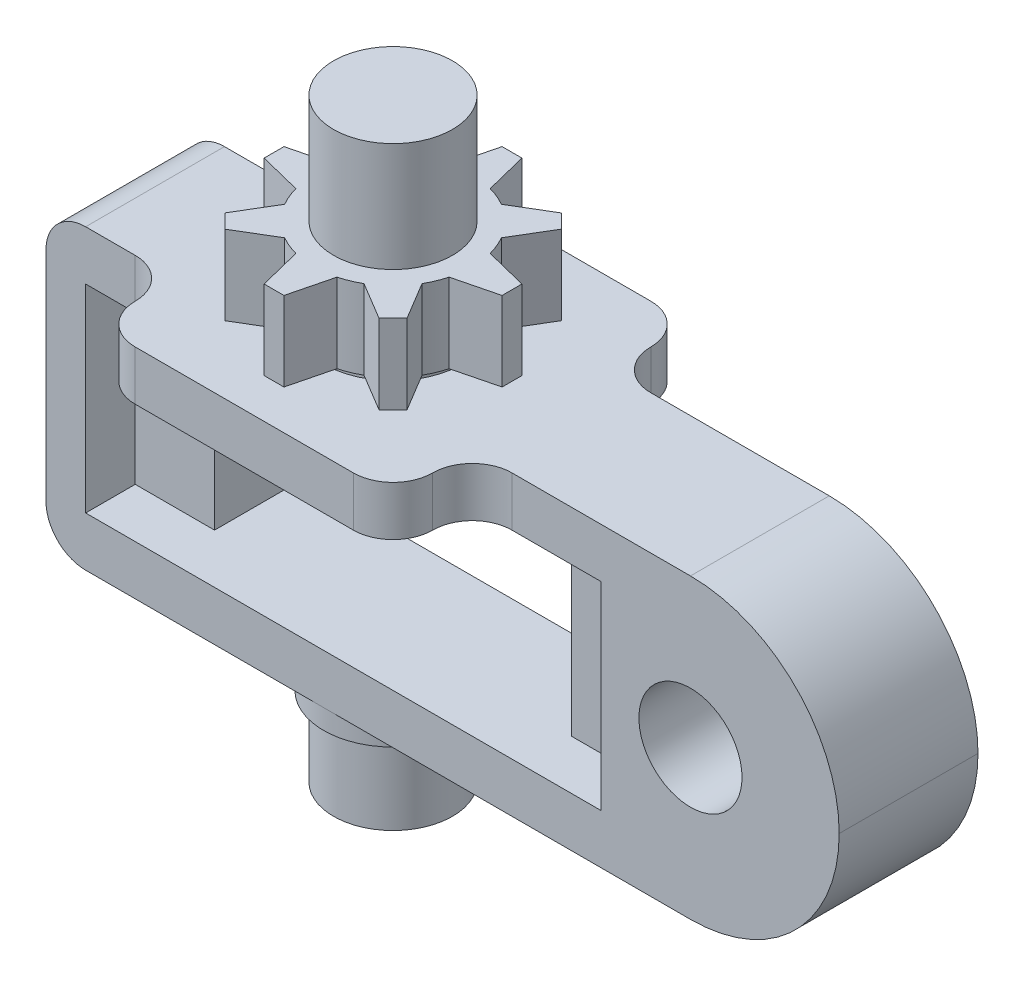
from build123d import *

# Parameters (mm, degrees)
SKETCH2_W               = 50.8
SKETCH2_H               = 19.05
BOSS_EXTRUDE1_DEPTH     = 4.445
CUT_EXTRUDE1_DEPTH      = 33.29387358
CUT_EXTRUDE1_DEPTH_BACK = 3.175
SKETCH4_W               = 33.02
SKETCH4_H               = 12.7
SKETCH6_W               = 22.86
SKETCH6_H               = 12.7
CUT_EXTRUDE2_DEPTH      = 29.546763827
FILLET2_R               = 9.525
SKETCH9_R               = 3.302
CUT_EXTRUDE4_DEPTH      = 29.546763827
SKETCH10_W              = 19.05
SKETCH10_H              = 19.05
BOSS_EXTRUDE2_DEPTH     = 3.175
FILLET1_R               = 2.54
SKETCH11_R              = 3.81
BOSS_EXTRUDE3_DEPTH     = 12.7
BOSS_EXTRUDE4_START     = 6.35
SKETCH12_R              = 3.81
BOSS_EXTRUDE4_DEPTH     = 6.35
SKETCH13_R              = 4.445
BOSS_EXTRUDE5_DEPTH     = 0.635
SKETCH14_R              = 5.08
BOSS_EXTRUDE6_DEPTH     = 5.08
BOSS_EXTRUDE7_DEPTH     = 5.08
CIRPATTERN1_COUNT       = 8
BOSS_EXTRUDE8_START     = 1.27
SKETCH16_R              = 4.445
BOSS_EXTRUDE8_DEPTH     = 1.27


# Some blends are built 0.0001 mm under size
with BuildPart() as part:
    # Sketch2 → Boss-Extrude1 (new, symmetric)
    with BuildSketch(Plane.XY):
        Rectangle(SKETCH2_W, SKETCH2_H)
    extrude(amount=BOSS_EXTRUDE1_DEPTH, both=True)

    # Sketch4 → Cut-Extrude1 (cut, two sides: drawn at the far end of the back side and taken through both)
    with BuildSketch(Plane(origin=(2.106978659, 4.870426214, 4.445), x_dir=(1, 0, 0), z_dir=(0, 0, 1)).offset(-CUT_EXTRUDE1_DEPTH_BACK)):
        with Locations((-8.456978659, -4.870426214)):
            Rectangle(SKETCH4_W, SKETCH4_H)
    extrude(amount=CUT_EXTRUDE1_DEPTH + CUT_EXTRUDE1_DEPTH_BACK, mode=Mode.SUBTRACT)

    # Sketch6 → Cut-Extrude2 (cut, through all)
    with BuildSketch(Plane(origin=(0, 0, -4.445), x_dir=(-1, 0, 0), z_dir=(0, 0, -1))):
        with Locations((6.35, 0)):
            Rectangle(SKETCH6_W, SKETCH6_H)
    extrude(amount=-CUT_EXTRUDE2_DEPTH, mode=Mode.SUBTRACT)

    # Fillet2
    fillet2_edges = [part.edges().sort_by_distance(p)[0] for p in [
        (25.4, -9.525, 0),
        (25.4, 9.525, 0),
    ]]
    fillet(fillet2_edges, radius=FILLET2_R - 0.0001)  # a hair under: the kernel refuses the full size

    # Sketch9 → Cut-Extrude4 (cut, through all)
    with BuildSketch(Plane.XY.offset(4.445)):
        with Locations((15.875, 0)):
            Circle(SKETCH9_R)
    extrude(amount=-CUT_EXTRUDE4_DEPTH, mode=Mode.SUBTRACT)

    # Sketch10 → Boss-Extrude2 (add)
    with BuildSketch(Plane(origin=(0, 9.525, 0), x_dir=(1, 0, 0), z_dir=(0, 1, 0))):
        with Locations((-7.62, 0)):
            Rectangle(SKETCH10_W, SKETCH10_H)
    extrude(amount=-BOSS_EXTRUDE2_DEPTH)

    # Fillet1
    # the kernel refuses this fillet: 2.54 mm, written as the material it adds along each edge
    with BuildSketch(Plane(origin=(-17.145, 9.525, -4.445), x_dir=(-1, 0, 0), z_dir=(0, -1, 0)), Plane(origin=(1.905, 6.35, -4.445), x_dir=(1, 0, 0), z_dir=(0, 1, 0))) as fillet1_piece_1:
        with BuildLine():
            CenterArc((FILLET1_R, FILLET1_R), FILLET1_R, 180, 90)
            Line((0, FILLET1_R), (0, 0))
            Line((0, 0), (FILLET1_R, 0))
        make_face()
    extrude(amount=3.175)
    with BuildSketch(Plane(origin=(1.905, 6.35, 4.445), x_dir=(1, 0, 0), z_dir=(0, 1, 0)), Plane(origin=(-17.145, 9.525, 4.445), x_dir=(-1, 0, 0), z_dir=(0, -1, 0))) as fillet1_piece_2:
        with BuildLine():
            CenterArc((FILLET1_R, -FILLET1_R), FILLET1_R, 90, 90)
            Line((0, -FILLET1_R), (0, 0))
            Line((0, 0), (FILLET1_R, 0))
        make_face()
    extrude(amount=3.175)
    # the kernel refuses this fillet: 2.54 mm, written as the material it takes off along each edge
    with BuildSketch(Plane(origin=(-25.4, -9.525, 10.795), x_dir=(1, 0, 0), z_dir=(0, 0, -1)), Plane(origin=(-25.4, 9.525, 10.795), x_dir=(0, -1, 0), z_dir=(0, 0, -1))) as fillet1_2_piece_1:
        with BuildLine():
            CenterArc((FILLET1_R, -FILLET1_R), FILLET1_R, 90, 90)
            Line((0, -FILLET1_R), (0, 0))
            Line((0, 0), (FILLET1_R, 0))
        make_face()
    extrude(amount=21.59, mode=Mode.SUBTRACT)
    with BuildSketch(Plane(origin=(-17.145, 15.875, -9.525), x_dir=(1, 0, 0), z_dir=(0, -1, 0)), Plane(origin=(1.905, 15.875, -9.525), x_dir=(0, 0, 1), z_dir=(0, -1, 0)), Plane(origin=(-17.145, 15.875, 9.525), x_dir=(0, 0, -1), z_dir=(0, -1, 0)), Plane(origin=(1.905, 15.875, 9.525), x_dir=(-1, 0, 0), z_dir=(0, -1, 0))) as fillet1_2_piece_2:
        with BuildLine():
            CenterArc((FILLET1_R, FILLET1_R), FILLET1_R, 180, 90)
            Line((0, FILLET1_R), (0, 0))
            Line((0, 0), (FILLET1_R, 0))
        make_face()
    extrude(amount=15.875, mode=Mode.SUBTRACT)

    # Sketch11 → Boss-Extrude3 (add)
    with BuildSketch(Plane(origin=(0, 9.525, 0), x_dir=(1, 0, 0), z_dir=(0, 1, 0))):
        with Locations(Location((-7.62, 0, 0), (0, 0, 90))):
            Circle(SKETCH11_R)
    extrude(amount=BOSS_EXTRUDE3_DEPTH)

    # Sketch12 → Boss-Extrude4 (add)
    with BuildSketch(Plane.XZ.offset(9.525).offset(BOSS_EXTRUDE4_START)):
        with Locations(Location((-7.62, 0, 0), (0, 0, 270))):
            Circle(SKETCH12_R)
    extrude(amount=-BOSS_EXTRUDE4_DEPTH)

    # Sketch13 → Boss-Extrude5 (add)
    with BuildSketch(Plane(origin=(0, 9.525, 0), x_dir=(1, 0, 0), z_dir=(0, 1, 0))):
        with Locations(Location((-7.62, 0, 0), (0, 0, 90))):
            Circle(SKETCH13_R)
    extrude(amount=BOSS_EXTRUDE5_DEPTH)

    # Sketch14 → Boss-Extrude6 (add)
    with BuildSketch(Plane(origin=(0, 10.16, 0), x_dir=(1, 0, 0), z_dir=(0, 1, 0))):
        with Locations(Location((-7.62, 0, 0), (0, 0, 270))):
            Circle(SKETCH14_R)
    extrude(amount=BOSS_EXTRUDE6_DEPTH)

    # Sketch15 → Boss-Extrude7 (add)
    with BuildSketch(Plane(origin=(0, 15.24, 0), x_dir=(1, 0, 0), z_dir=(0, 1, 0))):
        Polygon((-8.255, 7.62), (-6.985, 7.62), (-6.305199251, 4.906903198), (-8.934800749, 4.906903198), align=None)
    boss_extrude7 = extrude(amount=-BOSS_EXTRUDE7_DEPTH)

    # CirPattern1: Boss-Extrude7 ×8 about axis
    cirpattern1_axis = Axis((-7.62, 0, 0), (0, 1, 0))
    for i in range(1, CIRPATTERN1_COUNT):
        add(boss_extrude7.rotate(cirpattern1_axis, i * 360 / CIRPATTERN1_COUNT))

    # Sketch16 → Boss-Extrude8 (add)
    with BuildSketch(Plane.XZ.offset(9.525).offset(BOSS_EXTRUDE8_START)):
        with Locations(Location((-7.62, 0, 0), (0, 0, 270))):
            Circle(SKETCH16_R)
    extrude(amount=-BOSS_EXTRUDE8_DEPTH)


solid = part.part
